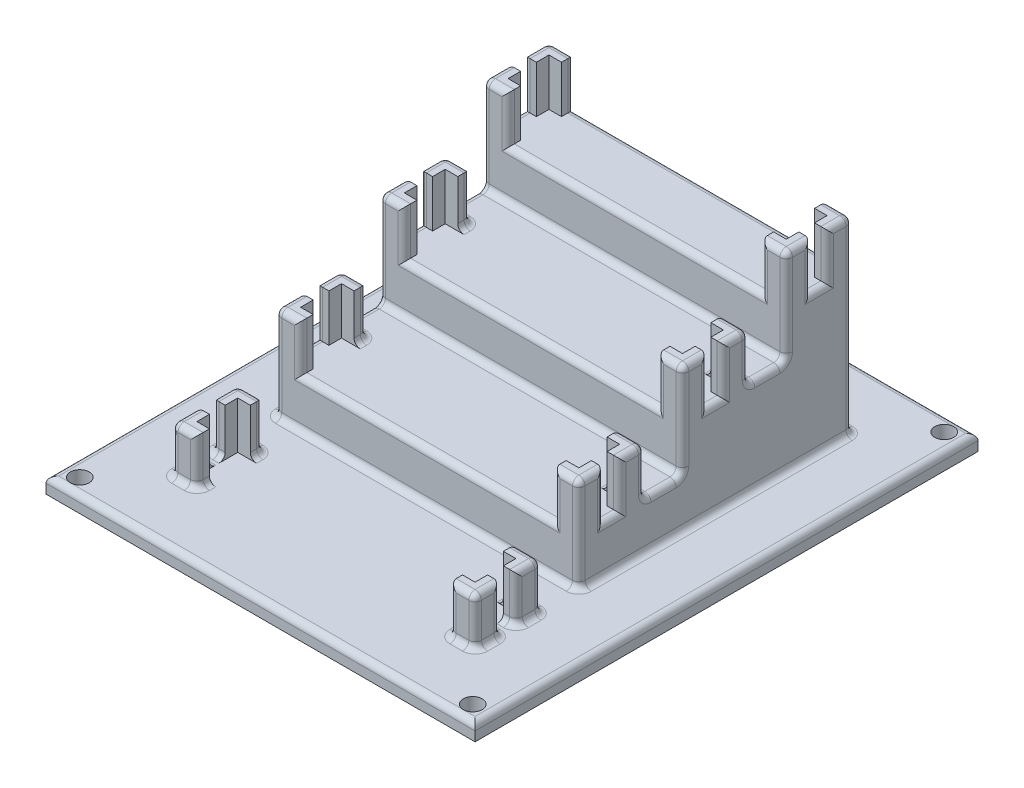
from build123d import *

# Parameters (mm, degrees)
BOSS_EXTRUDE1_DEPTH   = 15
BOSS_EXTRUDE1_2_DEPTH = 15
BOSS_EXTRUDE1_3_DEPTH = 15
BOSS_EXTRUDE1_4_DEPTH = 15
BOSS_EXTRUDE2_DEPTH   = 30
BOSS_EXTRUDE2_2_DEPTH = 30
BOSS_EXTRUDE2_3_DEPTH = 30
BOSS_EXTRUDE2_4_DEPTH = 30
BOSS_EXTRUDE3_DEPTH   = 45
BOSS_EXTRUDE3_2_DEPTH = 45
BOSS_EXTRUDE3_3_DEPTH = 45
BOSS_EXTRUDE3_4_DEPTH = 45
BOSS_EXTRUDE4_DEPTH   = 60
BOSS_EXTRUDE4_2_DEPTH = 60
BOSS_EXTRUDE4_3_DEPTH = 60
BOSS_EXTRUDE4_4_DEPTH = 60
SKETCH2_W             = 136.5
SKETCH2_H             = 160
BOSS_EXTRUDE5_DEPTH   = 5
SKETCH3_W             = 96.5
SKETCH3_H             = 33
BOSS_EXTRUDE7_DEPTH   = 15
SKETCH3_4_W           = 96.5
SKETCH3_4_H           = 33
BOSS_EXTRUDE8_DEPTH   = 30
SKETCH3_5_W           = 96.5
SKETCH3_5_H           = 21
BOSS_EXTRUDE9_DEPTH   = 45
F_6_0MM_DOWEL_HOLE1_D = 6
FILLET1_R             = 2


with BuildPart() as part:
    # Sketch1 → Boss-Extrude1 (new body)
    with BuildSketch(Plane(origin=(0, 0, 0), x_dir=(1, 0, 0), z_dir=(0, 1, 0))):
        Polygon((44.25, -105.5), (44.25, -101.5), (48.25, -101.5), (48.25, -109.5), (40.25, -109.5), (40.25, -105.5), align=None)
    extrude(amount=BOSS_EXTRUDE1_DEPTH)



with BuildPart() as body_2:
    # Sketch1 → Boss-Extrude1 2 (new body)
    with BuildSketch(Plane(origin=(0, 0, 0), x_dir=(1, 0, 0), z_dir=(0, 1, 0))):
        Polygon((44.25, -96.5), (48.25, -96.5), (48.25, -88.5), (40.25, -88.5), (40.25, -92.5), (44.25, -92.5), align=None)
    extrude(amount=BOSS_EXTRUDE1_2_DEPTH)


with BuildPart() as body_3:
    # Sketch1 → Boss-Extrude1 3 (new body)
    with BuildSketch(Plane(origin=(0, 0, 0), x_dir=(1, 0, 0), z_dir=(0, 1, 0))):
        Polygon((-40.25, -88.5), (-40.25, -92.5), (-44.25, -92.5), (-44.25, -96.5), (-48.25, -96.5), (-48.25, -88.5), align=None)
    extrude(amount=BOSS_EXTRUDE1_3_DEPTH)


with BuildPart() as body_4:
    # Sketch1 → Boss-Extrude1 4 (new body)
    with BuildSketch(Plane(origin=(0, 0, 0), x_dir=(1, 0, 0), z_dir=(0, 1, 0))):
        Polygon((-44.25, -101.5), (-44.25, -105.5), (-40.25, -105.5), (-40.25, -109.5), (-48.25, -109.5), (-48.25, -101.5), align=None)
    extrude(amount=BOSS_EXTRUDE1_4_DEPTH)


with BuildPart() as body_5:
    # Sketch1<11> → Boss-Extrude2 (new body)
    with BuildSketch(Plane(origin=(0, 0, 0), x_dir=(1, 0, 0), z_dir=(0, 1, 0))):
        Polygon((-48.25, -68.5), (-48.25, -76.5), (-40.25, -76.5), (-40.25, -72.5), (-44.25, -72.5), (-44.25, -68.5), align=None)
    extrude(amount=BOSS_EXTRUDE2_DEPTH)


with BuildPart() as body_6:
    # Sketch1<11> → Boss-Extrude2 2 (new body)
    with BuildSketch(Plane(origin=(0, 0, 0), x_dir=(1, 0, 0), z_dir=(0, 1, 0))):
        Polygon((-48.25, -55.5), (-48.25, -63.5), (-44.25, -63.5), (-44.25, -59.5), (-40.25, -59.5), (-40.25, -55.5), align=None)
    extrude(amount=BOSS_EXTRUDE2_2_DEPTH)


with BuildPart() as body_7:
    # Sketch1<11> → Boss-Extrude2 3 (new body)
    with BuildSketch(Plane(origin=(0, 0, 0), x_dir=(1, 0, 0), z_dir=(0, 1, 0))):
        Polygon((40.25, -59.5), (40.25, -55.5), (48.25, -55.5), (48.25, -63.5), (44.25, -63.5), (44.25, -59.5), align=None)
    extrude(amount=BOSS_EXTRUDE2_3_DEPTH)


with BuildPart() as body_8:
    # Sketch1<11> → Boss-Extrude2 4 (new body)
    with BuildSketch(Plane(origin=(0, 0, 0), x_dir=(1, 0, 0), z_dir=(0, 1, 0))):
        Polygon((40.25, -76.5), (48.25, -76.5), (48.25, -68.5), (44.25, -68.5), (44.25, -72.5), (40.25, -72.5), align=None)
    extrude(amount=BOSS_EXTRUDE2_4_DEPTH)


with BuildPart() as body_9:
    # Sketch1<12> → Boss-Extrude3 (new body)
    with BuildSketch(Plane(origin=(0, 0, 0), x_dir=(1, 0, 0), z_dir=(0, 1, 0))):
        Polygon((-48.25, -22.5), (-48.25, -30.5), (-44.25, -30.5), (-44.25, -26.5), (-40.25, -26.5), (-40.25, -22.5), align=None)
    extrude(amount=BOSS_EXTRUDE3_DEPTH)


with BuildPart() as body_10:
    # Sketch1<12> → Boss-Extrude3 2 (new body)
    with BuildSketch(Plane(origin=(0, 0, 0), x_dir=(1, 0, 0), z_dir=(0, 1, 0))):
        Polygon((40.25, -39.5), (44.25, -39.5), (44.25, -35.5), (48.25, -35.5), (48.25, -43.5), (40.25, -43.5), align=None)
    extrude(amount=BOSS_EXTRUDE3_2_DEPTH)


with BuildPart() as body_11:
    # Sketch1<12> → Boss-Extrude3 3 (new body)
    with BuildSketch(Plane(origin=(0, 0, 0), x_dir=(1, 0, 0), z_dir=(0, 1, 0))):
        Polygon((-48.25, -43.5), (-40.25, -43.5), (-40.25, -39.5), (-44.25, -39.5), (-44.25, -35.5), (-48.25, -35.5), align=None)
    extrude(amount=BOSS_EXTRUDE3_3_DEPTH)


with BuildPart() as body_12:
    # Sketch1<12> → Boss-Extrude3 4 (new body)
    with BuildSketch(Plane(origin=(0, 0, 0), x_dir=(1, 0, 0), z_dir=(0, 1, 0))):
        Polygon((48.25, -22.5), (48.25, -30.5), (44.25, -30.5), (44.25, -26.5), (40.25, -26.5), (40.25, -22.5), align=None)
    extrude(amount=BOSS_EXTRUDE3_4_DEPTH)


with BuildPart() as body_13:
    # Sketch1<13> → Boss-Extrude4 (new body)
    with BuildSketch(Plane(origin=(0, 0, 0), x_dir=(1, 0, 0), z_dir=(0, 1, 0))):
        Polygon((-44.25, -2.5), (-44.25, -6.5), (-40.25, -6.5), (-40.25, -10.5), (-48.25, -10.5), (-48.25, -2.5), align=None)
    extrude(amount=BOSS_EXTRUDE4_DEPTH)


with BuildPart() as body_14:
    # Sketch1<13> → Boss-Extrude4 2 (new body)
    with BuildSketch(Plane(origin=(0, 0, 0), x_dir=(1, 0, 0), z_dir=(0, 1, 0))):
        Polygon((-40.25, 10.5), (-40.25, 6.5), (-44.25, 6.5), (-44.25, 2.5), (-48.25, 2.5), (-48.25, 10.5), align=None)
    extrude(amount=BOSS_EXTRUDE4_2_DEPTH)


with BuildPart() as body_15:
    # Sketch1<13> → Boss-Extrude4 3 (new body)
    with BuildSketch(Plane(origin=(0, 0, 0), x_dir=(1, 0, 0), z_dir=(0, 1, 0))):
        Polygon((40.25, 6.5), (40.25, 10.5), (48.25, 10.5), (48.25, 2.5), (44.25, 2.5), (44.25, 6.5), align=None)
    extrude(amount=BOSS_EXTRUDE4_3_DEPTH)


with BuildPart() as body_16:
    # Sketch1<13> → Boss-Extrude4 4 (new body)
    with BuildSketch(Plane(origin=(0, 0, 0), x_dir=(1, 0, 0), z_dir=(0, 1, 0))):
        Polygon((40.25, -6.5), (44.25, -6.5), (44.25, -2.5), (48.25, -2.5), (48.25, -10.5), (40.25, -10.5), align=None)
    extrude(amount=BOSS_EXTRUDE4_4_DEPTH)


with BuildPart() as part_1:
    add(part.part)

    add(body_2.part)  # Boss-Extrude5 merges body 2

    add(body_3.part)  # Boss-Extrude5 merges body 3

    add(body_4.part)  # Boss-Extrude5 merges body 4

    add(body_5.part)  # Boss-Extrude5 merges body 5

    add(body_6.part)  # Boss-Extrude5 merges body 6

    add(body_7.part)  # Boss-Extrude5 merges body 7

    add(body_8.part)  # Boss-Extrude5 merges body 8

    add(body_9.part)  # Boss-Extrude5 merges body 9

    add(body_10.part)  # Boss-Extrude5 merges body 10

    add(body_11.part)  # Boss-Extrude5 merges body 11

    add(body_12.part)  # Boss-Extrude5 merges body 12

    add(body_13.part)  # Boss-Extrude5 merges body 13

    add(body_14.part)  # Boss-Extrude5 merges body 14

    add(body_15.part)  # Boss-Extrude5 merges body 15

    add(body_16.part)  # Boss-Extrude5 merges body 16
    # Sketch2 → Boss-Extrude5 (add)
    with BuildSketch(Plane(origin=(0, 0, 0), x_dir=(1, 0, 0), z_dir=(0, 1, 0))):
        with Locations((0, -49.5)):
            Rectangle(SKETCH2_W, SKETCH2_H)
    extrude(amount=-BOSS_EXTRUDE5_DEPTH)

    # Sketch3 → Boss-Extrude7 (add)
    with BuildSketch(Plane(origin=(0, 0, 0), x_dir=(1, 0, 0), z_dir=(0, 1, 0))):
        with Locations((0, -60)):
            Rectangle(SKETCH3_W, SKETCH3_H)
    extrude(amount=BOSS_EXTRUDE7_DEPTH)

    # Sketch3<4> → Boss-Extrude8 (add)
    with BuildSketch(Plane(origin=(0, 0, 0), x_dir=(1, 0, 0), z_dir=(0, 1, 0))):
        with Locations((0, -27)):
            Rectangle(SKETCH3_4_W, SKETCH3_4_H)
    extrude(amount=BOSS_EXTRUDE8_DEPTH)

    # Sketch3<5> → Boss-Extrude9 (add)
    with BuildSketch(Plane(origin=(0, 0, 0), x_dir=(1, 0, 0), z_dir=(0, 1, 0))):
        Rectangle(SKETCH3_5_W, SKETCH3_5_H)
    extrude(amount=BOSS_EXTRUDE9_DEPTH)

    # Ø6.0mm Dowel Hole1 (through all)
    with Locations(Plane(origin=(-62.5, 0, 124.5), x_dir=(0, 0, 1), z_dir=(0, 1, 0))):
        with Locations((0, 0), (-150, 0), (-150, 125), (0, 125)):
            Hole(F_6_0MM_DOWEL_HOLE1_D / 2)

    # Fillet1
    fillet1_edges = [part_1.edges().sort_by_distance(p)[0] for p in [
        (0, 0, -30.5),
        (-68.25, 0, 49.5),
        (68.25, 0, 49.5),
        (0, 0, 129.5),
        (46.25, 0, 101.5),
        (40.25, 0, 107.5),
        (48.25, 0, 105.5),
        (44.25, 0, 109.5),
        (46.25, 0, 96.5),
        (40.25, 0, 90.5),
        (48.25, 0, 92.5),
        (44.25, 0, 88.5),
        (-46.25, 0, 101.5),
        (-48.25, 0, 105.5),
        (-40.25, 0, 107.5),
        (-44.25, 0, 109.5),
        (-40.25, 0, 90.5),
        (-44.25, 0, 88.5),
        (-48.25, 0, 92.5),
        (-46.25, 0, 96.5),
        (48.25, 0, 33),
        (0, 0, -10.5),
        (0, 0, 76.5),
        (-48.25, 0, 33),
        (48.25, 7.5, 101.5),
        (40.25, 7.5, 109.5),
        (48.25, 7.5, 109.5),
        (48.25, 15, 105.5),
        (44.25, 15, 109.5),
        (48.25, 7.5, 96.5),
        (40.25, 7.5, 88.5),
        (48.25, 7.5, 88.5),
        (48.25, 15, 92.5),
        (44.25, 15, 88.5),
        (-48.25, 7.5, 101.5),
        (-48.25, 7.5, 109.5),
        (-48.25, 15, 105.5),
        (-40.25, 7.5, 109.5),
        (-44.25, 15, 109.5),
        (-40.25, 7.5, 88.5),
        (-48.25, 7.5, 88.5),
        (-44.25, 15, 88.5),
        (-48.25, 7.5, 96.5),
        (-48.25, 15, 92.5),
        (48.25, 30, -10.5),
        (48.25, 60, -6.5),
        (48.25, 52.5, -2.5),
        (48.25, 45, 0),
        (48.25, 52.5, 2.5),
        (48.25, 60, 6.5),
        (48.25, 45, 10.5),
        (48.25, 30, 16.5),
        (48.25, 37.5, 22.5),
        (48.25, 45, 26.5),
        (48.25, 37.5, 30.5),
        (48.25, 30, 33),
        (48.25, 37.5, 35.5),
        (48.25, 45, 39.5),
        (48.25, 30, 43.5),
        (48.25, 15, 49.5),
        (48.25, 22.5, 55.5),
        (48.25, 30, 59.5),
        (48.25, 22.5, 63.5),
        (48.25, 15, 66),
        (48.25, 22.5, 68.5),
        (48.25, 30, 72.5),
        (48.25, 15, 76.5),
        (-48.25, 30, -10.5),
        (-44.25, 60, -10.5),
        (-40.25, 52.5, -10.5),
        (0, 45, -10.5),
        (40.25, 52.5, -10.5),
        (44.25, 60, -10.5),
        (-48.25, 15, 76.5),
        (-44.25, 30, 76.5),
        (-40.25, 22.5, 76.5),
        (0, 15, 76.5),
        (40.25, 22.5, 76.5),
        (44.25, 30, 76.5),
        (-48.25, 30, 72.5),
        (-48.25, 60, -6.5),
        (-48.25, 52.5, -2.5),
        (-48.25, 45, 0),
        (-48.25, 52.5, 2.5),
        (-48.25, 60, 6.5),
        (-48.25, 45, 10.5),
        (-48.25, 30, 16.5),
        (-48.25, 37.5, 22.5),
        (-48.25, 45, 26.5),
        (-48.25, 37.5, 30.5),
        (-48.25, 30, 33),
        (-48.25, 37.5, 35.5),
        (-48.25, 45, 39.5),
        (-48.25, 30, 43.5),
        (-48.25, 15, 49.5),
        (-48.25, 22.5, 55.5),
        (-48.25, 30, 59.5),
        (-48.25, 22.5, 63.5),
        (-48.25, 15, 66),
        (-48.25, 22.5, 68.5),
        (0, 45, 10.5),
        (44.25, 60, 10.5),
        (40.25, 52.5, 10.5),
        (-40.25, 52.5, 10.5),
        (-44.25, 60, 10.5),
        (0, 30, 10.5),
        (44.25, 30, 22.5),
        (40.25, 30, 24.5),
        (0, 30, 43.5),
        (-40.25, 30, 24.5),
        (-44.25, 30, 22.5),
        (44.25, 45, 22.5),
        (40.25, 37.5, 22.5),
        (44.25, 45, 43.5),
        (-44.25, 45, 43.5),
        (-40.25, 37.5, 43.5),
        (40.25, 37.5, 43.5),
        (0, 15, 43.5),
        (40.25, 15, 57.5),
        (44.25, 15, 55.5),
        (-44.25, 15, 55.5),
        (-40.25, 15, 57.5),
        (44.25, 30, 55.5),
        (40.25, 22.5, 55.5),
        (-44.25, 45, 22.5),
        (-40.25, 37.5, 22.5),
        (-44.25, 30, 55.5),
        (-40.25, 22.5, 55.5),
    ]]
    fillet(fillet1_edges, radius=FILLET1_R - 0.0001)  # a hair under: the kernel refuses the full size


solid = part_1.part
